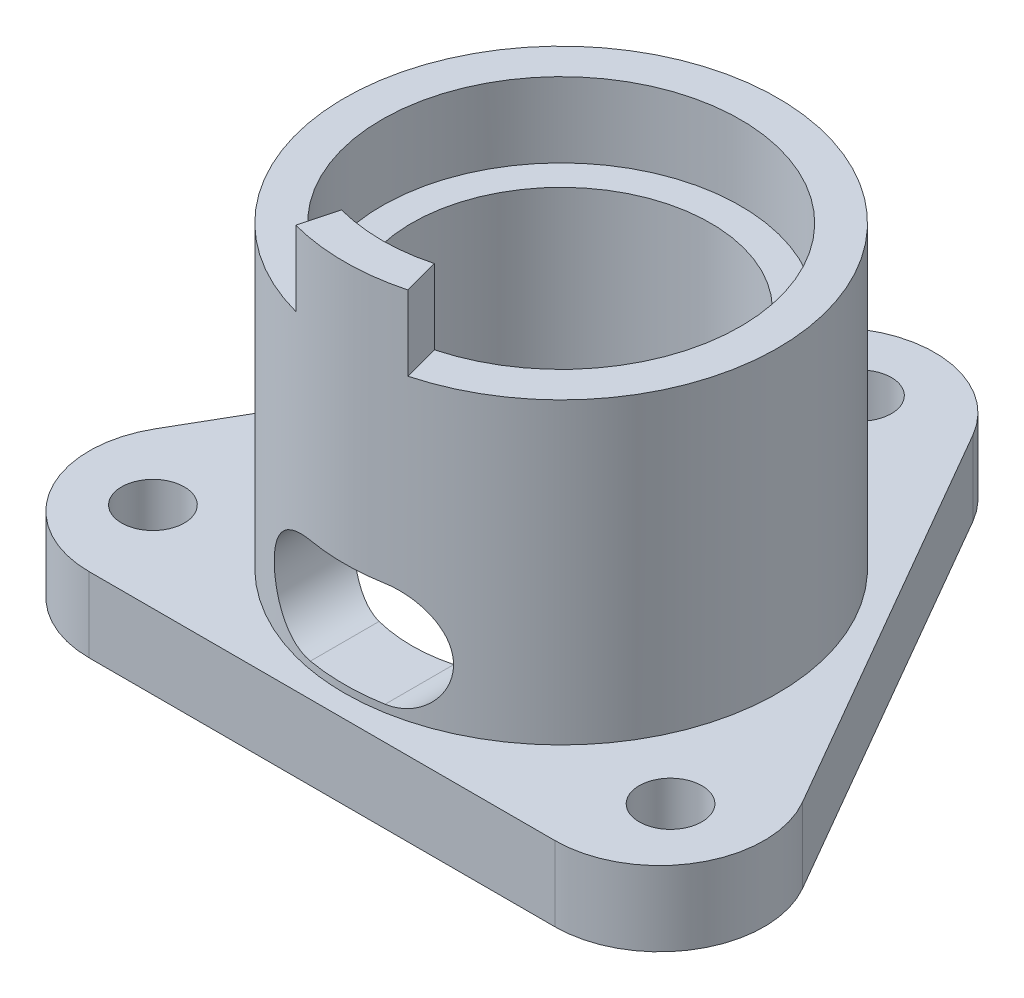
from build123d import *

# Parameters (mm, degrees)
SKETCH1_R           = 14.5
SKETCH1_R_2         = 10
BOSS_EXTRUDE1_DEPTH = 7.5
BOSS_EXTRUDE2_START = 5
SKETCH2_R           = 14.5
SKETCH2_R_2         = 12
BOSS_EXTRUDE2_DEPTH = 5
SKETCH3_R           = 12
SKETCH3_R_2         = 2.1
BOSS_EXTRUDE3_DEPTH = 5
FILLET1_R           = 7
BOSS_EXTRUDE4_START = 5
BOSS_EXTRUDE4_DEPTH = 5
CUT_EXTRUDE1_DEPTH  = 38.966938272


with BuildPart() as part:
    # Sketch1 → Boss-Extrude1 (new, symmetric)
    with BuildSketch(Plane(origin=(0, 0, 0), x_dir=(1, 0, 0), z_dir=(0, 1, 0))):
        Circle(SKETCH1_R)
        Circle(SKETCH1_R_2, mode=Mode.SUBTRACT)
    extrude(amount=BOSS_EXTRUDE1_DEPTH, both=True)

    # Sketch2 → Boss-Extrude2 (add)
    with BuildSketch(Plane(origin=(0, 7.5, 0), x_dir=(1, 0, 0), z_dir=(0, 1, 0)).offset(BOSS_EXTRUDE2_START)):
        Circle(SKETCH2_R)
        Circle(SKETCH2_R_2, mode=Mode.SUBTRACT)
    extrude(amount=-BOSS_EXTRUDE2_DEPTH)

    # Sketch3 → Boss-Extrude3 (add)
    with BuildSketch(Plane(origin=(0, -7.5, 0), x_dir=(-1, 0, 0), z_dir=(0, -1, 0))):
        Polygon((0, 32), (-27.712812921, -16), (27.712812921, -16), align=None)
        Circle(SKETCH3_R, mode=Mode.SUBTRACT)
        with Locations((17.320508076, -10)):
            Circle(SKETCH3_R_2, mode=Mode.SUBTRACT)
        with Locations((-17.320508076, -10)):
            Circle(SKETCH3_R_2, mode=Mode.SUBTRACT)
        with Locations((0, 20)):
            Circle(SKETCH3_R_2, mode=Mode.SUBTRACT)
    extrude(amount=BOSS_EXTRUDE3_DEPTH)

    # Fillet1
    fillet1_edges = [part.edges().sort_by_distance(p)[0] for p in [
        (-27.712812921, -10, 16),
        (27.712812921, -10, 16),
        (0, -10, -32),
    ]]
    fillet(fillet1_edges, radius=FILLET1_R)

    # Sketch4 → Boss-Extrude4 (add)
    with BuildSketch(Plane(origin=(0, 12.5, 0), x_dir=(1, 0, 0), z_dir=(0, 1, 0)).offset(BOSS_EXTRUDE4_START)):
        with BuildLine():
            Line((3.752876154, -14.005924481), (3.105828541, -11.591109915))
            ThreePointArc((3.105828541, -11.591109915), (0, -12), (-3.105828541, -11.591109915))
            Line((-3.105828541, -11.591109915), (-3.752876154, -14.005924481))
            ThreePointArc((-3.752876154, -14.005924481), (0, -14.5), (3.752876154, -14.005924481))
        make_face()
    extrude(amount=-BOSS_EXTRUDE4_DEPTH)

    # Sketch5 → Cut-Extrude1 (cut, through all)
    with BuildSketch(Plane.XY):
        with BuildLine():
            Line((-2.5, 0), (2.5, 0))
            ThreePointArc((2.5, 0), (6, -3.5), (2.5, -7))
            Line((2.5, -7), (-2.5, -7))
            ThreePointArc((-2.5, -7), (-6, -3.5), (-2.5, 0))
        make_face()
    extrude(amount=CUT_EXTRUDE1_DEPTH, mode=Mode.SUBTRACT)


solid = part.part
